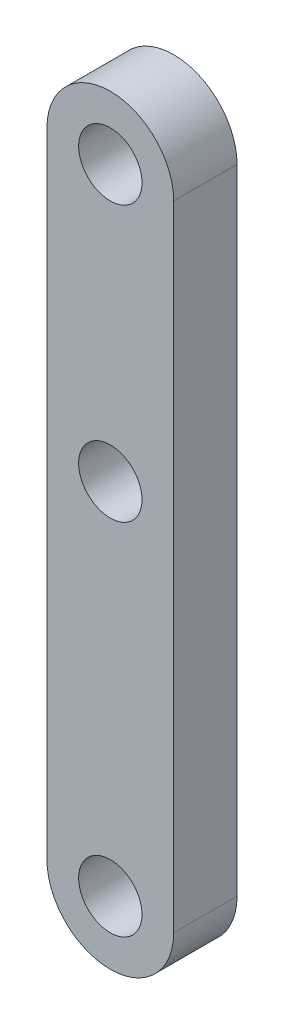
from build123d import *

# Parameters (mm, degrees)
SKETCH_1_R      = 1.5
EXTRUDE_1_DEPTH = 3


with BuildPart() as part:
    # ｽｹｯﾁ1 → ﾎﾞｽ - 押し出し1 (new body)
    with BuildSketch(Plane.XY):
        with BuildLine():
            Line((-3, 0), (-3, -30))
            ThreePointArc((-3, -30), (0, -33), (3, -30))
            Line((3, -30), (3, -12))
            Line((3, -12), (3, -8))
            Line((3, -8), (3, 0))
            ThreePointArc((3, 0), (0, 3), (-3, 0))
        make_face()
        Circle(SKETCH_1_R, mode=Mode.SUBTRACT)
        with Locations((0, -30)):
            Circle(SKETCH_1_R, mode=Mode.SUBTRACT)
        with Locations((0, -13)):
            Circle(SKETCH_1_R, mode=Mode.SUBTRACT)
    extrude(amount=EXTRUDE_1_DEPTH)


solid = part.part
